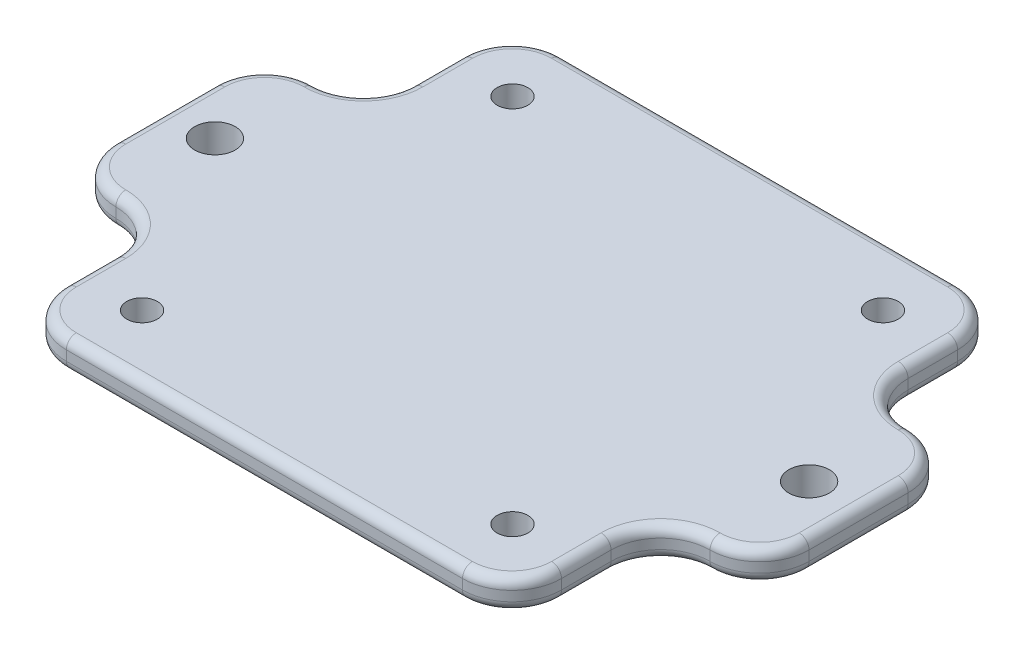
from build123d import *

# Parameters (mm, degrees)
CROQUIS1_R              = 1.55
CROQUIS1_R_2            = 2.05
SALIENTE_EXTRUIR1_DEPTH = 3
REDONDEO1_R             = 5
REDONDEO2_R             = 5
REDONDEO6_R             = 1
REDONDEO7_R             = 1


with BuildPart() as part:
    # Croquis1 → Saliente-Extruir1 (new body)
    with BuildSketch(Plane(origin=(0, 0, 0), x_dir=(1, 0, 0), z_dir=(0, 1, 0))):
        Polygon((25, 9.656797923), (35, 9.656797923), (35, -10.343202077), (25, -10.343202077), (25, -25.343202077), (-25, -25.343202077), (-25, -10.343202077), (-35, -10.343202077), (-35, 9.656797923), (-25, 9.656797923), (-25, 24.656797923), (25, 24.656797923), align=None)
        with Locations(Location((-18.64, -19.063202077, 0), (0, 0, 270))):
            Circle(CROQUIS1_R, mode=Mode.SUBTRACT)
        with Locations(Location((18.77, -19.063202077, 0), (0, 0, 270))):
            Circle(CROQUIS1_R, mode=Mode.SUBTRACT)
        with Locations(Location((18.77, 18.346797923, 0), (0, 0, 270))):
            Circle(CROQUIS1_R, mode=Mode.SUBTRACT)
        with Locations(Location((-18.64, 18.346797923, 0), (0, 0, 270))):
            Circle(CROQUIS1_R, mode=Mode.SUBTRACT)
        with Locations(Location((-30, -0.343202077, 0), (0, 0, 270))):
            Circle(CROQUIS1_R_2, mode=Mode.SUBTRACT)
        with Locations(Location((30, -0.343202077, 0), (0, 0, 270))):
            Circle(CROQUIS1_R_2, mode=Mode.SUBTRACT)
    extrude(amount=SALIENTE_EXTRUIR1_DEPTH)

    # Redondeo1
    redondeo1_edges = [part.edges().sort_by_distance(p)[0] for p in [
        (35, 1.5, -9.656797923),
        (35, 1.5, 10.343202077),
        (25, 1.5, 25.343202077),
        (-25, 1.5, 25.343202077),
        (-35, 1.5, 10.343202077),
        (-35, 1.5, -9.656797923),
        (-25, 1.5, -24.656797923),
        (25, 1.5, -24.656797923),
    ]]
    fillet(redondeo1_edges, radius=REDONDEO1_R)

    # Redondeo2
    redondeo2_edges = [part.edges().sort_by_distance(p)[0] for p in [
        (25, 1.5, -9.656797923),
        (-25, 1.5, -9.656797923),
        (-25, 1.5, 10.343202077),
        (25, 1.5, 10.343202077),
    ]]
    fillet(redondeo2_edges, radius=REDONDEO2_R - 0.0001)  # a hair under: the kernel refuses the full size

    # Redondeo6
    redondeo6_edges = [part.edges().sort_by_distance(p)[0] for p in [
        (25, 3, -17.156747923),
        (-25, 3, 17.843152077),
        (26.464436805, 3, -11.121234728),
        (-26.464436805, 3, -11.121234728),
        (-26.464436805, 3, 11.807638881),
        (26.464436805, 3, 11.807638881),
        (-35, 3, 0.343202077),
        (0, 3, -24.656797923),
        (-25, 3, -17.156747923),
        (0, 3, 25.343202077),
        (25, 3, 17.843152077),
        (35, 3, 0.343202077),
        (-33.535533906, 3, 8.878735982),
        (-23.535533906, 3, 23.878735982),
        (23.535533906, 3, 23.878735982),
        (33.535533906, 3, 8.878735982),
        (33.535533906, 3, -8.192331829),
        (23.535533906, 3, -23.192331829),
        (-23.535533906, 3, -23.192331829),
        (-33.535533906, 3, -8.192331829),
    ]]
    fillet(redondeo6_edges, radius=REDONDEO6_R)

    # Redondeo7
    redondeo7_edges = [part.edges().sort_by_distance(p)[0] for p in [
        (25, 0, -17.156747923),
        (-25, 0, 17.843152077),
        (26.464436805, 0, -11.121234728),
        (-26.464436805, 0, -11.121234728),
        (-26.464436805, 0, 11.807638881),
        (26.464436805, 0, 11.807638881),
        (-35, 0, 0.343202077),
        (35, 0, 0.343202077),
        (25, 0, 17.843152077),
        (0, 0, 25.343202077),
        (-25, 0, -17.156747923),
        (0, 0, -24.656797923),
        (-33.535533906, 0, 8.878735982),
        (-23.535533906, 0, 23.878735982),
        (23.535533906, 0, 23.878735982),
        (33.535533906, 0, 8.878735982),
        (33.535533906, 0, -8.192331829),
        (23.535533906, 0, -23.192331829),
        (-23.535533906, 0, -23.192331829),
        (-33.535533906, 0, -8.192331829),
    ]]
    fillet(redondeo7_edges, radius=REDONDEO7_R)


solid = part.part
